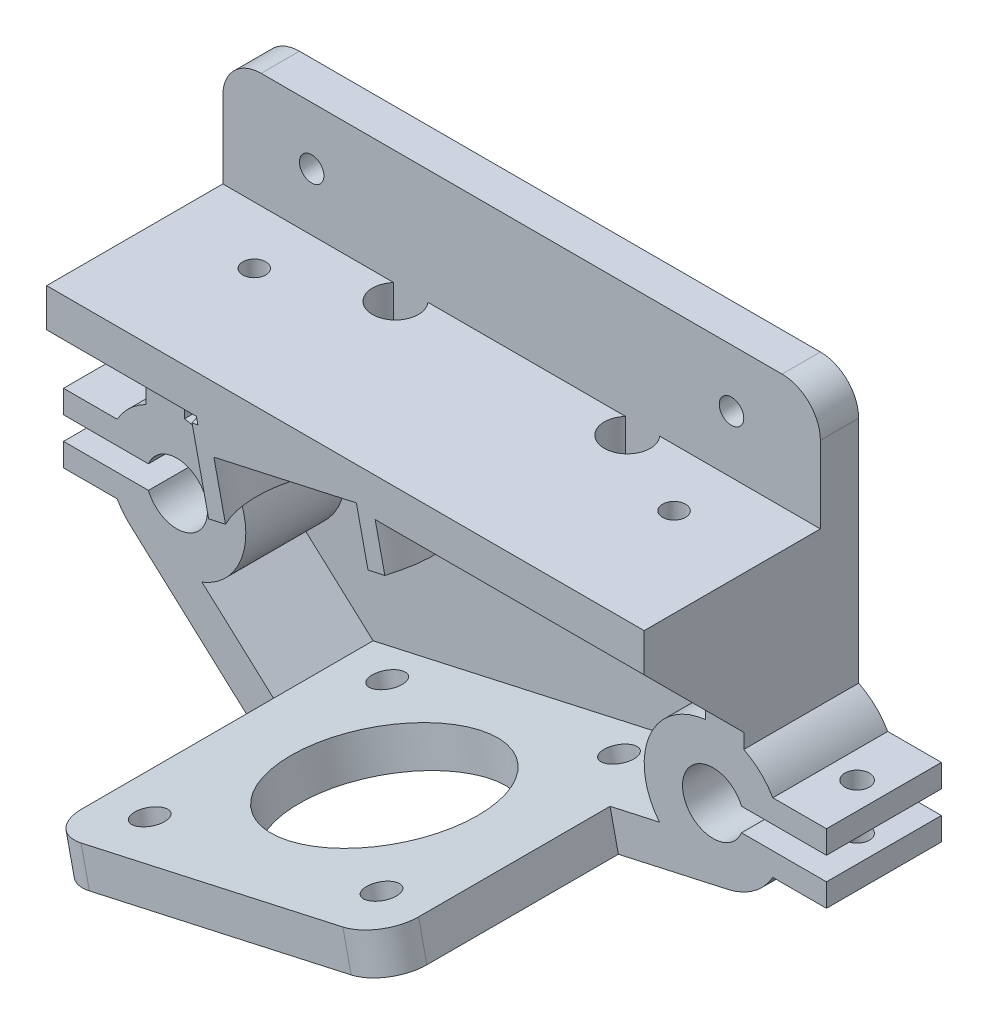
from build123d import *

# Parameters (mm, degrees)
BOSS_EXTRUDE1_DEPTH = 15
SKETCH2_R           = 1.6
CUT_EXTRUDE1_DEPTH  = 62.324670446
BOSS_EXTRUDE2_DEPTH = 30
FILLET1_R           = 5
CUT_EXTRUDE2_REACH  = 84.635
SKETCH4_R           = 12.5
SKETCH4_R_2         = 2
BOSS_EXTRUDE3_DEPTH = 2
BOSS_EXTRUDE4_DEPTH = 26
SKETCH7_W           = 78
SKETCH7_H           = 13
BOSS_EXTRUDE5_DEPTH = 5
BOSS_EXTRUDE6_DEPTH = 10
SKETCH9_R           = 11
CUT_EXTRUDE4_DEPTH  = 7
CHAMFER1_SIZE       = 13
SKETCH10_W          = 78
SKETCH10_H          = 5
BOSS_EXTRUDE7_DEPTH = 15
SKETCH11_R          = 1.6
CUT_EXTRUDE5_DEPTH  = 77.996527229
CUT_EXTRUDE6_REACH  = 85.597
SKETCH12_R          = 1.5
FILLET2_R           = 5
CUT_EXTRUDE7_REACH  = 85.597


with BuildPart() as part:
    # Sketch1 → Boss-Extrude1 (new body)
    with BuildSketch(Plane.XY):
        with BuildLine():
            Line((-39, 28), (39, 28))
            Line((39, 28), (39, 8.062257748))
            ThreePointArc((39, 8.062257748), (41.160225429, 6.561373535), (42.794228634, 4.5))
            Line((42.794228634, 4.5), (49.794228634, 4.5))
            Line((49.794228634, 4.5), (49.794228634, 1.5))
            Line((49.794228634, 1.5), (38.708099244, 1.5))
            ThreePointArc((38.708099244, 1.5), (31, 0), (38.708099244, -1.5))
            Line((38.708099244, -1.5), (49.794228634, -1.5))
            Line((49.794228634, -1.5), (49.794228634, -4.5))
            Line((49.794228634, -4.5), (42.794228634, -4.5))
            ThreePointArc((42.794228634, -4.5), (40.323053514, -7.257072501), (36.951023531, -8.785983564))
            Line((36.951023531, -8.785983564), (-23.82345919, -22.281620679))
            Line((-23.82345919, -22.281620679), (-41.045145267, -6.667549678))
            ThreePointArc((-41.045145267, -6.667549678), (-42.004044217, -5.651846124), (-42.794228634, -4.5))
            Line((-42.794228634, -4.5), (-49.794228634, -4.5))
            Line((-49.794228634, -4.5), (-49.794228634, -1.5))
            Line((-49.794228634, -1.5), (-38.708099244, -1.5))
            ThreePointArc((-38.708099244, -1.5), (-31, 0), (-38.708099244, 1.5))
            Line((-38.708099244, 1.5), (-49.794228634, 1.5))
            Line((-49.794228634, 1.5), (-49.794228634, 4.5))
            Line((-49.794228634, 4.5), (-42.794228634, 4.5))
            ThreePointArc((-42.794228634, 4.5), (-41.160225429, 6.561373535), (-39, 8.062257748))
            Line((-39, 8.062257748), (-39, 28))
        make_face()
        with BuildLine():
            Line((-34, 23), (34, 23))
            Line((34, 23), (34, 8.94427191))
            ThreePointArc((34, 8.94427191), (26.676479172, 3.423302649), (27.996581118, -5.652620982))
            Line((27.996581118, -5.652620982), (-22.38171768, -16.839672004))
            Line((-22.38171768, -16.839672004), (-31.713897446, -8.378635331))
            ThreePointArc((-31.713897446, -8.378635331), (-26.077363193, 1.177519599), (-34, 8.94427191))
            Line((-34, 8.94427191), (-34, 23))
        make_face(mode=Mode.SUBTRACT)
    extrude(amount=BOSS_EXTRUDE1_DEPTH)

    # Sketch2 → Cut-Extrude1 (cut, through all)
    with BuildSketch(Plane.XZ.offset(4.5)):
        with Locations((-46.294228634, 7.5)):
            Circle(SKETCH2_R)
        with Locations((46.294228634, 7.5)):
            Circle(SKETCH2_R)
    extrude(amount=-CUT_EXTRUDE1_DEPTH, mode=Mode.SUBTRACT)

    # Sketch3 → Boss-Extrude2 (add)
    with BuildSketch(Plane.XY.offset(15)):
        Polygon((-22.38171768, -16.839672004), (-21.297815718, -21.720773984), (22.6321021, -11.965656329), (21.548200138, -7.084554349), align=None)
    extrude(amount=BOSS_EXTRUDE2_DEPTH)

    # Fillet1
    fillet1_edges = [part.edges().sort_by_distance(p)[0] for p in [
        (-23.82345919, -22.281620679, 7.5),
        (22.090151119, -9.525105339, 45),
        (-21.839766699, -19.280222994, 45),
    ]]
    fillet(fillet1_edges, radius=FILLET1_R)

    # Sketch4 → Cut-Extrude2 (cut, up to next)
    with BuildSketch(Plane(origin=(3.595804379, -16.192873979, 0), x_dir=(0.9762203959642155, 0.21678039234089044, 0), z_dir=(0.21678039234089044, -0.9762203959642155, 0)), mode=Mode.PRIVATE) as cut_extrude2_sk1:
        with Locations((-3, 22.5)):
            Circle(SKETCH4_R)
    cut_extrude2_tool1 = extrude(cut_extrude2_sk1.sketch, amount=-CUT_EXTRUDE2_REACH, mode=Mode.PRIVATE) & part.part
    # Sketch4 → Cut-Extrude2 (cut, up to next)
    with BuildSketch(Plane(origin=(3.595804379, -16.192873979, 0), x_dir=(0.9762203959642155, 0.21678039234089044, 0), z_dir=(0.21678039234089044, -0.9762203959642155, 0)), mode=Mode.PRIVATE) as cut_extrude2_sk2:
        with Locations((-18.5, 38)):
            Circle(SKETCH4_R_2)
    cut_extrude2_tool2 = extrude(cut_extrude2_sk2.sketch, amount=-CUT_EXTRUDE2_REACH, mode=Mode.PRIVATE) & part.part
    # Sketch4 → Cut-Extrude2 (cut, up to next)
    with BuildSketch(Plane(origin=(3.595804379, -16.192873979, 0), x_dir=(0.9762203959642155, 0.21678039234089044, 0), z_dir=(0.21678039234089044, -0.9762203959642155, 0)), mode=Mode.PRIVATE) as cut_extrude2_sk3:
        with Locations((12.5, 38)):
            Circle(SKETCH4_R_2)
    cut_extrude2_tool3 = extrude(cut_extrude2_sk3.sketch, amount=-CUT_EXTRUDE2_REACH, mode=Mode.PRIVATE) & part.part
    # Sketch4 → Cut-Extrude2 (cut, up to next)
    with BuildSketch(Plane(origin=(3.595804379, -16.192873979, 0), x_dir=(0.9762203959642155, 0.21678039234089044, 0), z_dir=(0.21678039234089044, -0.9762203959642155, 0)), mode=Mode.PRIVATE) as cut_extrude2_sk4:
        with Locations((12.5, 7)):
            Circle(SKETCH4_R_2)
    cut_extrude2_tool4 = extrude(cut_extrude2_sk4.sketch, amount=-CUT_EXTRUDE2_REACH, mode=Mode.PRIVATE) & part.part
    # Sketch4 → Cut-Extrude2 (cut, up to next)
    with BuildSketch(Plane(origin=(3.595804379, -16.192873979, 0), x_dir=(0.9762203959642155, 0.21678039234089044, 0), z_dir=(0.21678039234089044, -0.9762203959642155, 0)), mode=Mode.PRIVATE) as cut_extrude2_sk5:
        with Locations((-18.5, 7)):
            Circle(SKETCH4_R_2)
    cut_extrude2_tool5 = extrude(cut_extrude2_sk5.sketch, amount=-CUT_EXTRUDE2_REACH, mode=Mode.PRIVATE) & part.part
    add(cut_extrude2_tool1.solids().sort_by_distance((0.667143, -16.843215, 22.5))[0], mode=Mode.SUBTRACT)
    add(cut_extrude2_tool2.solids().sort_by_distance((-14.464273, -20.203311, 38))[0], mode=Mode.SUBTRACT)
    add(cut_extrude2_tool3.solids().sort_by_distance((15.798559, -13.483119, 38))[0], mode=Mode.SUBTRACT)
    add(cut_extrude2_tool4.solids().sort_by_distance((15.798559, -13.483119, 7))[0], mode=Mode.SUBTRACT)
    add(cut_extrude2_tool5.solids().sort_by_distance((-14.464273, -20.203311, 7))[0], mode=Mode.SUBTRACT)

    # Sketch5 → Boss-Extrude3 (add)
    with BuildSketch(Plane(origin=(0, 0, 0), x_dir=(-1, 0, 0), z_dir=(0, 0, -1))):
        Polygon((-34, 23), (-34, 8.94427191), (-27.996581118, -5.652620982), (22.38171768, -16.839672004), (31.713897446, -8.378635331), (29.251891486, 2.846497001), (34, 8.94427191), (34, 23), align=None)
    extrude(amount=-BOSS_EXTRUDE3_DEPTH)

    # Sketch6 → Boss-Extrude4 (add)
    with BuildSketch(Plane.XY.offset(2)):
        Polygon((3.087469785, 23), (4.388152139, 17.142677624), (-17.088696572, 12.373508993), (-19.448424866, 23), align=None)
    extrude(amount=BOSS_EXTRUDE4_DEPTH)

    # Sketch7 → Boss-Extrude5 (add)
    with BuildSketch(Plane(origin=(0, 23, 0), x_dir=(1, 0, 0), z_dir=(0, 1, 0))):
        with Locations((0, -21.5)):
            Rectangle(SKETCH7_W, SKETCH7_H)
    extrude(amount=BOSS_EXTRUDE5_DEPTH)

    # Sketch8 → Boss-Extrude6 (add)
    with BuildSketch(Plane(origin=(-3.421611029, 15.408434485, 0), x_dir=(0.9762203959642155, 0.21678039234089055, 0), z_dir=(0.21678039234089053, -0.9762203959642154, 0))):
        with BuildLine():
            Line((-14.779218989, 28), (-12.526279442, 28))
            ThreePointArc((-12.526279442, 28), (-3, 11.5), (6.526279442, 28))
            Line((6.526279442, 28), (8.779218989, 28))
            ThreePointArc((8.779218989, 28), (-3, 9.5), (-14.779218989, 28))
        make_face()
    extrude(amount=-BOSS_EXTRUDE6_DEPTH)

    # Sketch9 → Cut-Extrude4 (cut)
    with BuildSketch(Plane(origin=(-3.421611029, 15.408434485, 0), x_dir=(0.9762203959642155, 0.21678039234089055, 0), z_dir=(0.21678039234089053, -0.9762203959642154, 0))):
        with Locations((-3, 22.5)):
            Circle(SKETCH9_R)
    extrude(amount=-CUT_EXTRUDE4_DEPTH, mode=Mode.SUBTRACT)

    # Chamfer1
    chamfer1_edges = [part.edges().sort_by_distance(p)[0] for p in [
        (-36.5, 23, 15),
        (36.5, 23, 15),
    ]]
    chamfer(chamfer1_edges, length=CHAMFER1_SIZE - 0.0001)  # a hair under: the kernel refuses the full size

    # Sketch10 → Boss-Extrude7 (add)
    with BuildSketch(Plane(origin=(0, 28, 0), x_dir=(1, 0, 0), z_dir=(0, 1, 0))):
        with Locations((0, -2.5)):
            Rectangle(SKETCH10_W, SKETCH10_H)
    extrude(amount=BOSS_EXTRUDE7_DEPTH)

    # Sketch11 → Cut-Extrude5 (cut, through all)
    with BuildSketch(Plane.XY.offset(5)):
        with Locations((-27.4, 35.5)):
            Circle(SKETCH11_R)
        with Locations((27.4, 35.5)):
            Circle(SKETCH11_R)
    extrude(amount=-CUT_EXTRUDE5_DEPTH, mode=Mode.SUBTRACT)

    # Sketch12 → Cut-Extrude6 (cut, up to next)
    with BuildSketch(Plane(origin=(0, 28, 0), x_dir=(1, 0, 0), z_dir=(0, 1, 0)), mode=Mode.PRIVATE) as cut_extrude6_sk1:
        with Locations(Location((27.4, -12.5, 0), (0, 0, 270))):
            Circle(SKETCH12_R)
    cut_extrude6_tool1 = extrude(cut_extrude6_sk1.sketch, amount=-CUT_EXTRUDE6_REACH, mode=Mode.PRIVATE) & part.part
    # Sketch12 → Cut-Extrude6 (cut, up to next)
    with BuildSketch(Plane(origin=(0, 28, 0), x_dir=(1, 0, 0), z_dir=(0, 1, 0)), mode=Mode.PRIVATE) as cut_extrude6_sk2:
        with Locations(Location((-27.4, -12.5, 0), (0, 0, 270))):
            Circle(SKETCH12_R)
    cut_extrude6_tool2 = extrude(cut_extrude6_sk2.sketch, amount=-CUT_EXTRUDE6_REACH, mode=Mode.PRIVATE) & part.part
    add(cut_extrude6_tool1.solids().sort_by_distance((27.4, 28, 12.5))[0], mode=Mode.SUBTRACT)
    add(cut_extrude6_tool2.solids().sort_by_distance((-27.4, 28, 12.5))[0], mode=Mode.SUBTRACT)

    # Fillet2
    fillet2_edges = [part.edges().sort_by_distance(p)[0] for p in [
        (-39, 43, 2.5),
        (39, 43, 2.5),
    ]]
    fillet(fillet2_edges, radius=FILLET2_R)

    # Sketch14 → Cut-Extrude7 (cut, up to next)
    with BuildSketch(Plane(origin=(0, 28, 0), x_dir=(1, 0, 0), z_dir=(0, 1, 0)), mode=Mode.PRIVATE) as cut_extrude7_sk1:
        with BuildLine():
            Line((18.034627306, -5), (13.562491351, -5))
            ThreePointArc((13.562491351, -5), (15.798559328, -10), (18.034627306, -5))
        make_face()
    cut_extrude7_tool1 = extrude(cut_extrude7_sk1.sketch, amount=-CUT_EXTRUDE7_REACH, mode=Mode.PRIVATE) & part.part
    # Sketch14 → Cut-Extrude7 (cut, up to next)
    with BuildSketch(Plane(origin=(0, 28, 0), x_dir=(1, 0, 0), z_dir=(0, 1, 0)), mode=Mode.PRIVATE) as cut_extrude7_sk2:
        with BuildLine():
            Line((-12.228204969, -5), (-16.700340924, -5))
            ThreePointArc((-16.700340924, -5), (-14.464272947, -10), (-12.228204969, -5))
        make_face()
    cut_extrude7_tool2 = extrude(cut_extrude7_sk2.sketch, amount=-CUT_EXTRUDE7_REACH, mode=Mode.PRIVATE) & part.part
    add(cut_extrude7_tool1.solids().sort_by_distance((15.798559, 28, 7.296048))[0], mode=Mode.SUBTRACT)
    add(cut_extrude7_tool2.solids().sort_by_distance((-14.464273, 28, 7.296048))[0], mode=Mode.SUBTRACT)


solid = part.part
